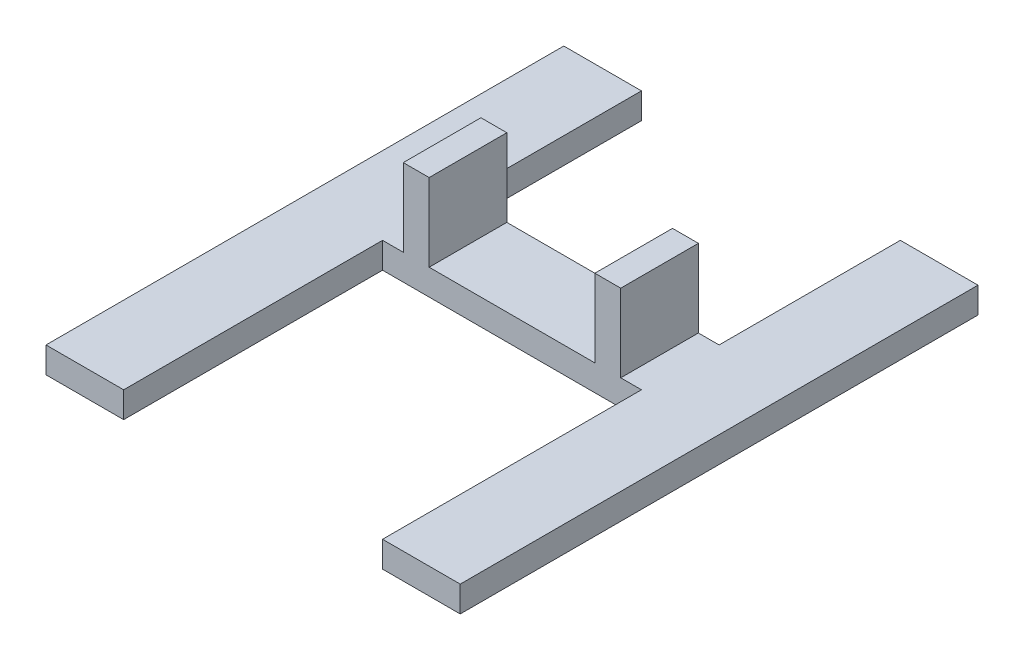
from build123d import *

# Parameters (mm, degrees)
BOSS_EXTRUDE1_DEPTH = 2.5
SKETCH2_W           = 5
SKETCH2_H           = 15
BOSS_EXTRUDE2_DEPTH = 15


with BuildPart() as part:
    # Sketch1 → Boss-Extrude1 (new, symmetric)
    with BuildSketch(Plane(origin=(0, 0, 0), x_dir=(1, 0, 0), z_dir=(0, 1, 0))):
        Polygon((0, 100), (0, 0), (15, 0), (15, 50), (65, 50), (65, 0), (80, 0), (80, 100), (65, 100), (65, 65), (15, 65), (15, 100), align=None)
    extrude(amount=BOSS_EXTRUDE1_DEPTH, both=True)

    # Sketch2 → Boss-Extrude2 (add)
    with BuildSketch(Plane(origin=(0, 2.5, 0), x_dir=(1, 0, 0), z_dir=(0, 1, 0))):
        with Locations((58.5, 57.5)):
            Rectangle(SKETCH2_W, SKETCH2_H)
        with Locations((21.5, 57.5)):
            Rectangle(SKETCH2_W, SKETCH2_H)
    extrude(amount=BOSS_EXTRUDE2_DEPTH)


solid = part.part
